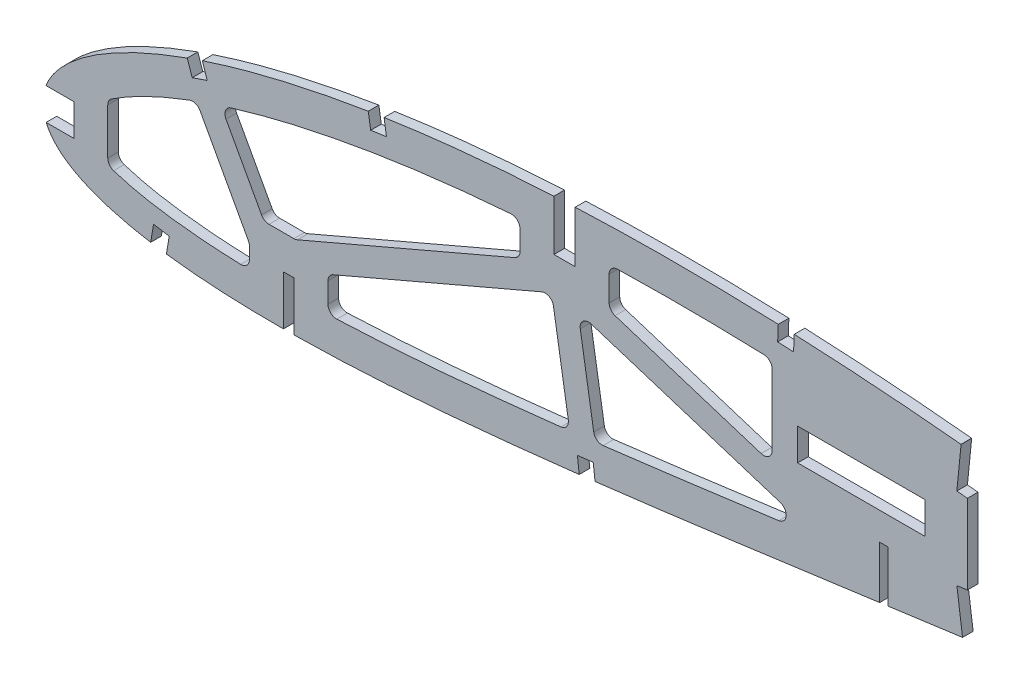
from build123d import *

# Parameters (mm, degrees)
BOSS_EXTRUDE1_DEPTH = 3.175
CUT_EXTRUDE1_DEPTH  = 7.62
SKETCH3_R           = 6.35
CUT_EXTRUDE2_DEPTH  = 7.62
SKETCH4_R           = 6.35
SKETCH4_W           = 9.525
SKETCH4_H           = 9.525
SKETCH4_W_2         = 38.1
CUT_EXTRUDE3_DEPTH  = 443.627115857
CUT_EXTRUDE4_DEPTH  = 282.962875242
FILLET1_R           = 2.54


with BuildPart() as part:
    # Sketch1 → Boss-Extrude1 (new body)
    with BuildSketch(Plane.XY):
        with BuildLine():
            Line((435.33010469, 0.678691456), (439.172882547, -1.614212492))
            Line((439.172882547, -1.614212492), (434.787151486, -0.678691456))
            add(Edge.make_bspline(
                [(0, 0), (0.11179123, -0.527729161), (0.335887463, -1.58561283), (0.94472768, -3.108527015), (1.749889805, -4.572488672), (2.768272335, -5.973609192), (3.993104005, -7.311505618), (5.421679636, -8.587569541), (7.052598221, -9.801114861), (8.883725224, -10.951589231), (10.912400596, -12.040213999), (13.136344152, -13.066312264), (15.553528081, -14.029563428), (18.161318821, -14.928679795), (20.956528242, -15.765030781), (23.936498821, -16.536578215), (27.097842034, -17.244400464), (30.437517266, -17.886690773), (33.951885298, -18.464101669), (37.637295209, -18.976309975), (41.489964184, -19.423636044), (45.506112459, -19.80514129), (49.681767661, -20.121646285), (54.012767863, -20.373360955), (58.494909036, -20.561083494), (63.123897762, -20.684100336), (67.895200479, -20.744329207), (72.804505265, -20.742674403), (77.847009648, -20.678693244), (83.018406129, -20.555920262), (88.313732191, -20.373577887), (93.728207214, -20.133872554), (99.256947275, -19.839216685), (104.89499369, -19.49060908), (110.637384794, -19.089594814), (116.479134607, -18.639389777), (122.414936441, -18.141116951), (128.439613477, -17.597680601), (134.547832047, -17.011801372), (140.734314746, -16.385333349), (146.993600903, -15.721223571), (153.320115485, -15.021624036), (159.708476563, -14.290267097), (166.152848405, -13.528475979), (172.647781594, -12.740600204), (179.187166024, -11.928145018), (185.765533466, -11.094239816), (192.376967293, -10.242811017), (199.015278084, -9.37376151), (205.674882543, -8.493282903), (212.349358377, -7.600650086), (219.032895906, -6.7004538), (225.719308248, -5.795492203), (232.402082768, -4.886043807), (239.075345122, -3.975877517), (245.732904616, -3.06749205), (252.368240069, -2.160970285), (258.975348295, -1.26081803), (265.547576185, -0.366925322), (272.078863439, 0.518895586), (278.562951189, 1.394000598), (284.993721977, 2.257285217), (291.364542133, 3.108203268), (297.66900214, 3.947074317), (303.806375969, 4.748436439), (309.760626579, 5.554962658), (315.551818652, 6.216135275), (321.27090305, 6.780469964), (326.923820465, 7.243146515), (332.503782957, 7.610821489), (338.004397185, 7.886122043), (343.419107553, 8.072891719), (348.74107448, 8.176671364), (353.963650696, 8.200094537), (359.079707468, 8.150631139), (364.082590991, 8.032268225), (368.965318868, 7.850318702), (373.721079318, 7.610921079), (378.343117125, 7.320601554), (382.824493294, 6.983642622), (387.158963185, 6.607910686), (391.339839301, 6.198906082), (395.360701925, 5.761301701), (399.215684034, 5.304267166), (402.898615263, 4.830811549), (406.403955911, 4.348715399), (409.726063296, 3.862864382), (412.859676284, 3.379461168), (415.799871302, 2.903117573), (418.541899149, 2.440155772), (421.081464376, 1.994901374), (423.414160264, 1.571702591), (425.536750687, 1.175899009), (427.445043551, 0.809456817), (429.136486586, 0.478415007), (430.607934716, 0.184234372), (431.857230885, -0.068940506), (432.88219343, -0.280110359), (433.681265576, -0.445808771), (434.252869013, -0.566300363), (434.596385478, -0.637999126), (434.749014267, -0.670556399), (434.787151486, -0.678691456)],
                knots=[0, 0, 0, 0, 0.003638255, 0.007293231, 0.011028136, 0.014901081, 0.018963272, 0.023258475, 0.027820626, 0.032679082, 0.03785316, 0.043361875, 0.049214679, 0.055422346, 0.061988786, 0.068918036, 0.076211157, 0.083868392, 0.091887411, 0.100265912, 0.108999867, 0.118084529, 0.127514843, 0.13728527, 0.147387917, 0.157816481, 0.168563473, 0.179619128, 0.190977373, 0.202626974, 0.214560478, 0.226767249, 0.239236417, 0.251959004, 0.264923894, 0.278119703, 0.291536035, 0.30516028, 0.318980685, 0.332985499, 0.34716279, 0.361498603, 0.375980747, 0.390597192, 0.405332593, 0.420174823, 0.435109533, 0.450124276, 0.465203068, 0.480333154, 0.495500583, 0.510689775, 0.525887334, 0.541078314, 0.556247233, 0.571381785, 0.58646604, 0.601484515, 0.616424329, 0.631269423, 0.646006524, 0.660620684, 0.675098187, 0.689422858, 0.703581825, 0.716907563, 0.730009274, 0.742952128, 0.755725557, 0.768319951, 0.780724337, 0.792926528, 0.804916041, 0.816679084, 0.828203525, 0.8394749, 0.850481359, 0.861207697, 0.871639326, 0.881763414, 0.891563605, 0.901027365, 0.910138977, 0.918883977, 0.927249278, 0.935221104, 0.942784739, 0.949928188, 0.956638465, 0.962904203, 0.968712288, 0.974054485, 0.978918432, 0.983297219, 0.987180246, 0.990560674, 0.993433357, 0.995790626, 0.997629588, 0.998945816, 0.999736592, 1, 1, 1, 1], degree=3))
            add(Edge.make_bspline(
                [(435.33010469, 0.678691456), (435.296755582, 0.699293055), (435.163488681, 0.781619431), (434.863214309, 0.965803828), (434.363194901, 1.272571896), (433.663211466, 1.69979322), (432.763807452, 2.246333125), (431.664530435, 2.908364558), (430.366066728, 3.683736897), (428.86873043, 4.568782589), (427.172675107, 5.559358025), (425.278546429, 6.651449737), (423.186509465, 7.838875427), (420.897374442, 9.116782681), (418.411926851, 10.4790944), (415.730636684, 11.919657082), (412.854464224, 13.43114364), (409.784513475, 15.00705265), (406.521344218, 16.638681918), (403.066494801, 18.319240705), (399.421116368, 20.040349747), (395.586453278, 21.79282696), (391.56470833, 23.569527811), (387.356993489, 25.359407096), (382.965706604, 27.15470981), (378.392717175, 28.945218407), (373.640732922, 30.722778715), (368.711587102, 32.475875028), (363.608964359, 34.196846251), (358.335340013, 35.87451254), (352.894485425, 37.499762392), (347.289561815, 39.062058655), (341.52524157, 40.553388886), (335.605180365, 41.962892679), (329.534395845, 43.28113527), (323.317713598, 44.500180123), (316.960347344, 45.607856696), (310.479914041, 46.603301327), (303.980682286, 47.431342852), (297.494822244, 48.243461645), (291.0186212, 49.006373108), (284.46326746, 49.736966294), (277.835067652, 50.431127833), (271.140596349, 51.086687253), (264.386630807, 51.700815013), (257.580189535, 52.27171033), (250.727858804, 52.796138155), (243.836864005, 53.273290553), (236.914017847, 53.698972807), (229.966694004, 54.072865307), (223.001944897, 54.392360355), (216.027018499, 54.655256617), (209.049321182, 54.859966995), (202.076096041, 55.004530305), (195.114893299, 55.088037667), (188.172953688, 55.108207309), (181.257823923, 55.064678381), (174.376745271, 54.95595632), (167.537272154, 54.780552763), (160.7466557, 54.538140281), (154.012238926, 54.228824112), (147.341395315, 53.850013849), (140.741361553, 53.404123644), (134.219487317, 52.889280335), (127.782938298, 52.305347044), (121.438460058, 51.65475786), (115.193116172, 50.935743156), (109.053599754, 50.150348891), (103.026626206, 49.300114834), (97.118957953, 48.384577869), (91.33692342, 47.406382542), (85.686763085, 46.366529581), (80.174454785, 45.268067638), (74.805999973, 44.111283189), (69.587081438, 42.899646299), (64.52312301, 41.635267927), (59.619568317, 40.320462769), (54.881388132, 38.958385816), (50.313373811, 37.552127128), (45.920850559, 36.103231966), (41.707138151, 34.617193881), (37.677412709, 33.095067788), (33.834761135, 31.541542875), (30.183686712, 29.958740393), (26.726916941, 28.351485511), (23.468364091, 26.721608068), (20.41035055, 25.073674406), (17.555946308, 23.410211446), (14.907899047, 21.73430892), (12.467321746, 20.050217809), (10.237579271, 18.35899521), (8.219437586, 16.664914738), (6.414173801, 14.97055608), (4.824368385, 13.277086383), (3.449964137, 11.587487839), (2.292762263, 9.903098559), (1.352963468, 8.225512409), (0.632693499, 6.555947979), (0.13123808, 4.895344207), (-0.143255259, 3.246152095), (-0.211578297, 1.607049514), (-0.07042072, 0.534882766), (0, 0)],
                knots=[0, 0, 0, 0, 0.00025409, 0.001015373, 0.002283359, 0.004056577, 0.006330982, 0.009105274, 0.012374489, 0.016134023, 0.02037966, 0.025105976, 0.030306237, 0.035972206, 0.042099522, 0.048678064, 0.055701664, 0.063160184, 0.071045824, 0.079349826, 0.08806291, 0.097175756, 0.106678112, 0.116561573, 0.126814275, 0.137428301, 0.148393618, 0.15969976, 0.171338126, 0.183297699, 0.195569604, 0.208143556, 0.221011593, 0.234161831, 0.24758745, 0.261276822, 0.27522271, 0.289414144, 0.303771199, 0.317689227, 0.331784111, 0.346039677, 0.36044387, 0.37498272, 0.389640454, 0.404403316, 0.419256601, 0.434186749, 0.449177265, 0.464214782, 0.479284009, 0.49436974, 0.509457833, 0.524532346, 0.53957932, 0.554582984, 0.569529546, 0.584403417, 0.599190992, 0.613876838, 0.628447475, 0.642888675, 0.657186054, 0.671325546, 0.685294014, 0.699078147, 0.712665095, 0.726042645, 0.739197713, 0.752117586, 0.764792042, 0.777208152, 0.789355685, 0.80122396, 0.812803686, 0.824082909, 0.835054602, 0.845709571, 0.856037853, 0.866033834, 0.875688843, 0.884997719, 0.893953426, 0.902552897, 0.910789386, 0.918660734, 0.926166253, 0.933302626, 0.94007122, 0.94647478, 0.952517526, 0.958204819, 0.963546652, 0.9685566, 0.973249913, 0.977651041, 0.981787043, 0.985694226, 0.989415109, 0.993001157, 0.996508416, 1, 1, 1, 1], degree=3))
        make_face()
    extrude(amount=BOSS_EXTRUDE1_DEPTH)

    # Sketch2 → Cut-Extrude1 (cut)
    with BuildSketch(Plane(origin=(0, 0, 0), x_dir=(-1, 0, 0), z_dir=(0, 0, -1))):
        Polygon((-252.794440989, 13.221493744), (-250.254440989, 13.221493744), (-250.254440989, -2.115243028), (-250.254440989, -3.986349358), (-252.794440989, -3.050796193), (-252.794440989, -2.115243028), align=None)
        Polygon((-159.131940989, 54.422217902), (-159.131940989, 39.039100326), (-152.781940989, 39.039100326), (-152.781940989, 54.422217902), (-152.781940989, 57.645440557), (-159.131940989, 55.540936844), align=None)
        Polygon((-74.994440989, -5.928775484), (-74.994440989, -20.141805429), (-74.994440989, -20.97642061), (-71.819440989, -22.145862066), (-71.819440989, -20.141805429), (-71.819440989, -5.928775484), align=None)
    extrude(amount=-CUT_EXTRUDE1_DEPTH, mode=Mode.SUBTRACT)

    # Sketch3 → Cut-Extrude2 (cut)
    with BuildSketch(Plane(origin=(0, 0, 0), x_dir=(-1, 0, 0), z_dir=(0, 0, -1))):
        with Locations((-292.383806588, 26.255421435)):
            Circle(SKETCH3_R)
    extrude(amount=-CUT_EXTRUDE2_DEPTH, mode=Mode.SUBTRACT)

    # Sketch4 → Cut-Extrude3 (cut, through all)
    # profile 1 of 8: a face of its own
    with BuildSketch(Plane.XY.offset(3.175)):
        Polygon((273.349658498, 38.028091323), (276.508806588, 37.713859181), (276.508806588, 13.934637567), (273.362227422, 13.510785566), (275.057635426, 0.924468904), (275.057635426, -18.833084933), (446.086196565, -18.833084933), (446.086196565, 59.944128913), (274.606587067, 59.944128913), (274.606587067, 50.664683683), align=None)
        with Locations((292.383806588, 26.255421435)):
            Circle(SKETCH4_R, mode=Mode.SUBTRACT)
    # profile 2 of 8: a face of its own
    with BuildSketch(Plane.XY.offset(3.175)):
        Polygon((219.725798523, 49.849814949), (224.483551568, 49.643099482), (224.699134715, 54.39602519), (219.913383026, 54.599169296), align=None)
    # profile 3 of 8: a face of its own
    with BuildSketch(Plane.XY.offset(3.175)):
        Polygon((160.344166624, -14.245519658), (165.08273478, -13.687201683), (164.522590598, -8.953423812), (159.793087001, -9.513059826), align=None)
    # profile 4 of 8: a face of its own
    with BuildSketch(Plane.XY.offset(3.175)):
        Polygon((97.936400792, 43.798607145), (102.645386654, 44.510393866), (101.932356003, 49.227816219), (97.189663066, 48.482556517), align=None)
    # profile 5 of 8: a face of its own
    with BuildSketch(Plane.XY.offset(3.175)):
        Polygon((32.952371753, -13.02357497), (31.569110721, -21.303459904), (36.2027681, -22.077571832), (36.838817299, -18.581245887), (37.641753761, -13.808241987), align=None)
    # profile 6 of 8: a face of its own
    with BuildSketch(Plane.XY.offset(3.175)):
        Polygon((44.512019179, 30.71972624), (49.020517996, 32.253888691), (47.492010314, 36.746220213), (42.989627567, 35.192918258), align=None)
    # profile 7 of 8: a face of its own
    with BuildSketch(Plane.XY.offset(3.175)):
        with Locations((4.32104865, 2.047838827)):
            Rectangle(SKETCH4_W, SKETCH4_H)
    # profile 8 of 8: a face of its own
    with BuildSketch(Plane.XY.offset(3.175)):
        with Locations((244.758806588, 26.255421435)):
            Rectangle(SKETCH4_W_2, SKETCH4_H)
    extrude(amount=-CUT_EXTRUDE3_DEPTH, mode=Mode.SUBTRACT)

    # Sketch5 → Cut-Extrude4 (cut, through all)
    with BuildSketch(Plane.XY.offset(3.175)):
        with BuildLine():
            add(Edge.make_bspline(
                [(45.814840569, 25.282367443), (43.822791815, 24.562865162), (39.215196122, 22.812244039), (32.181765676, 19.775215547), (26.104065444, 16.671015264), (22.150956813, 14.309546417), (20.27302683, 13.083140574), (19.503800794, 12.556245905), (19.24354865, 12.374877898)],
                knots=[0.874077053, 0.874077053, 0.874077053, 0.874077053, 0.888527775, 0.907825838, 0.927123901, 0.936772932, 0.94141287, 0.943825127, 0.943825127, 0.943825127, 0.943825127], degree=3))
            Line((19.24354865, 12.374877898), (19.24354865, -4.539137798))
            add(Edge.make_bspline(
                [(19.24354865, -4.539137798), (19.525981613, -4.642890342), (20.216795523, -4.889295377), (22.0966215, -5.515008888), (26.203155938, -6.690360656), (32.713182772, -8.045600453), (40.841334575, -9.183638157), (49.096619858, -9.934839763), (55.360075179, -10.273048988), (59.539003509, -10.420924337), (60.952190291, -10.460753472), (61.659440989, -10.478274979)],
                knots=[0.049763351, 0.049763351, 0.049763351, 0.049763351, 0.052230608, 0.055729778, 0.065598805, 0.08533686, 0.105074914, 0.124812969, 0.144188224, 0.149122738, 0.154057251, 0.154057251, 0.154057251, 0.154057251], degree=3))
            Line((61.659440989, -10.478274979), (61.659440989, -3.714397612))
            Line((61.659440989, -3.714397612), (45.814840569, 25.282367443))
        make_face()
        with BuildLine():
            add(Edge.make_bspline(
                [(142.621940989, 43.341052807), (141.16277336, 43.237100158), (137.894505535, 42.99177607), (128.804678048, 42.228619487), (115.386854733, 40.817080153), (98.089203191, 38.358558503), (80.973623404, 35.187832938), (66.936657893, 31.856735994), (57.726991023, 29.21501171), (54.069296834, 28.07024065), (53.137796451, 27.772072652)],
                knots=[0.654625525, 0.654625525, 0.654625525, 0.654625525, 0.664274557, 0.676249084, 0.714845209, 0.753441335, 0.792037461, 0.830633587, 0.84993165, 0.856554759, 0.856554759, 0.856554759, 0.856554759], degree=3))
            Line((53.137796451, 27.772072652), (66.001139364, 4.231224516))
            Line((66.001139364, 4.231224516), (75.488690109, 4.231224516))
            Line((75.488690109, 4.231224516), (142.621940989, 33.024751821))
            Line((142.621940989, 33.024751821), (142.621940989, 43.341052807))
        make_face()
        with BuildLine():
            Line((85.154440989, 0.085573021), (85.154440989, -10.31403894))
            add(Edge.make_bspline(
                [(85.154440989, -10.31403894), (90.221688375, -10.141635354), (101.039010532, -9.613219564), (117.637914667, -8.40013339), (136.679570306, -6.638548813), (149.971615588, -5.18667662), (157.497572739, -4.315203925)],
                knots=[0.208311845, 0.208311845, 0.208311845, 0.208311845, 0.243241296, 0.282717405, 0.322193514, 0.373662797, 0.373662797, 0.373662797, 0.373662797], degree=3))
            Line((157.497572739, -4.315203925), (152.109291457, 28.802584187))
            Line((152.109291457, 28.802584187), (85.154440989, 0.085573021))
        make_face()
        with BuildLine():
            add(Edge.make_bspline(
                [(218.088806588, 44.407248442), (215.149456111, 44.514285011), (209.270778872, 44.697237468), (195.225915283, 44.981634592), (181.89596248, 44.964543834), (171.518848439, 44.720101194), (169.291940989, 44.656607646)],
                knots=[0.489112922, 0.489112922, 0.489112922, 0.489112922, 0.508410985, 0.527709048, 0.581332198, 0.595990863, 0.595990863, 0.595990863, 0.595990863], degree=3))
            Line((169.291940989, 44.656607646), (169.291940989, 32.87623272))
            Line((169.291940989, 32.87623272), (218.088806588, 17.395653345))
            Line((218.088806588, 17.395653345), (218.088806588, 44.407248442))
        make_face()
        with BuildLine():
            Line((159.987096536, 27.833886694), (165.07247877, -3.422204529))
            add(Edge.make_bspline(
                [(165.07247877, -3.422204529), (166.566956941, -3.243055154), (179.610552739, -1.664978362), (201.671667742, 1.19592823), (222.259411165, 3.987166397), (231.282036291, 5.215897599)],
                knots=[0.390928193, 0.390928193, 0.390928193, 0.390928193, 0.401145733, 0.480097951, 0.541640306, 0.541640306, 0.541640306, 0.541640306], degree=3))
            Line((231.282036291, 5.215897599), (159.987096536, 27.833886694))
        make_face()
    extrude(amount=-CUT_EXTRUDE4_DEPTH, mode=Mode.SUBTRACT)

    # Fillet1
    fillet1_edges = [part.edges().sort_by_distance(p)[0] for p in [
        (169.291940989, 32.87623272, 1.5875),
        (169.291940989, 44.656607646, 1.5875),
        (218.088806588, 44.407248442, 1.5875),
        (218.088806588, 17.395653345, 1.5875),
        (19.24354865, 12.374877898, 1.5875),
        (45.814840569, 25.282367443, 1.5875),
        (61.659440989, -3.714397612, 1.5875),
        (19.24354865, -4.539137798, 1.5875),
        (85.154440989, 0.085573021, 1.5875),
        (152.109291457, 28.802584187, 1.5875),
        (157.497572739, -4.315203925, 1.5875),
        (85.154440989, -10.31403894, 1.5875),
        (142.621940989, 33.024751821, 1.5875),
        (75.488690109, 4.231224516, 1.5875),
        (66.001139364, 4.231224516, 1.5875),
        (53.137796451, 27.772072652, 1.5875),
        (142.621940989, 43.341052807, 1.5875),
        (159.987096536, 27.833886694, 1.5875),
        (231.282036291, 5.215897599, 1.5875),
        (165.07247877, -3.422204529, 1.5875),
        (61.659440989, -10.478274979, 1.5875),
    ]]
    fillet(fillet1_edges, radius=FILLET1_R)


solid = part.part
